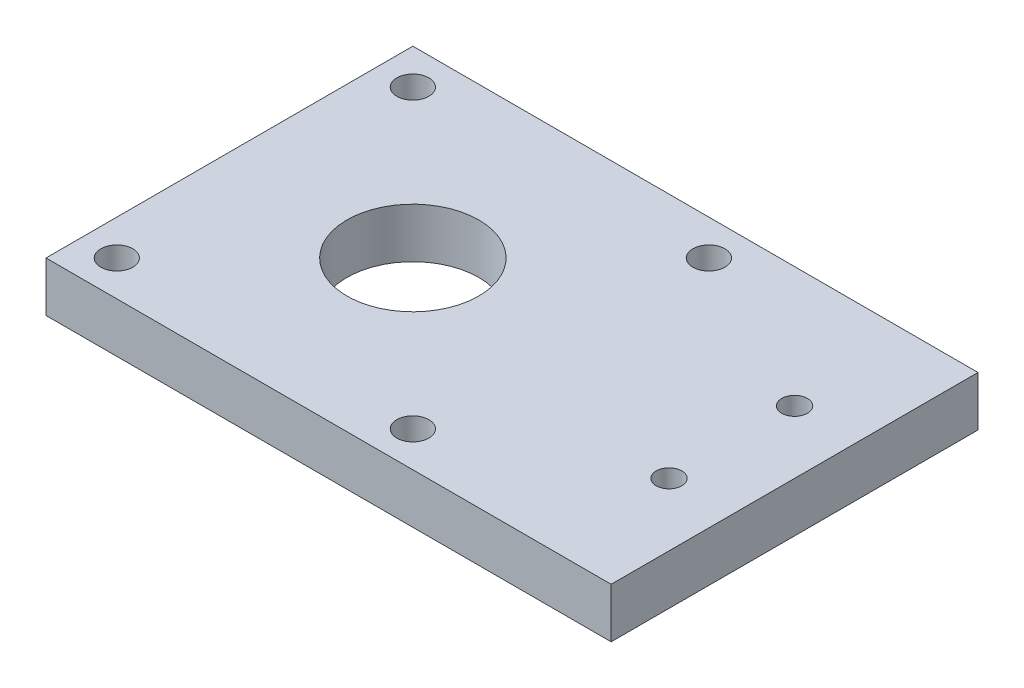
from build123d import *

# Parameters (mm, degrees)
SKETCH1_W           = 90
SKETCH1_H           = 58.42
SKETCH1_R           = 2.55
SKETCH1_R_2         = 2.05
SKETCH1_R_3         = 10.5
BOSS_EXTRUDE1_DEPTH = 7.9375


with BuildPart() as part:
    # Sketch1 → Boss-Extrude1 (new body)
    with BuildSketch(Plane.XZ.offset(110.068674648)):
        with Locations((40.506748586, 71.609111908)):
            Rectangle(SKETCH1_W, SKETCH1_H)
        with Locations((1.146748586, 95.179111908)):
            Circle(SKETCH1_R, mode=Mode.SUBTRACT)
        with Locations((1.146748586, 48.039111908)):
            Circle(SKETCH1_R, mode=Mode.SUBTRACT)
        with Locations((48.286748586, 48.039111908)):
            Circle(SKETCH1_R, mode=Mode.SUBTRACT)
        with Locations((48.286748586, 95.179111908)):
            Circle(SKETCH1_R, mode=Mode.SUBTRACT)
        with Locations((75.506748586, 81.609111908)):
            Circle(SKETCH1_R_2, mode=Mode.SUBTRACT)
        with Locations((75.506748586, 61.609111908)):
            Circle(SKETCH1_R_2, mode=Mode.SUBTRACT)
        with Locations((24.716748586, 71.609111908)):
            Circle(SKETCH1_R_3, mode=Mode.SUBTRACT)
    extrude(amount=BOSS_EXTRUDE1_DEPTH)


solid = part.part
